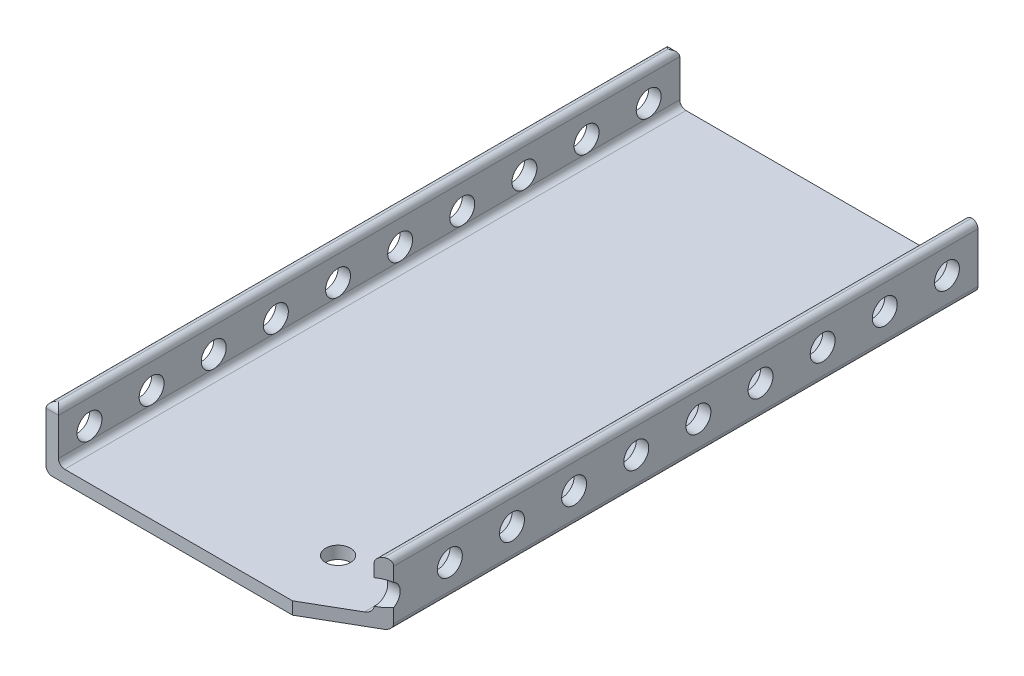
from build123d import *

# Parameters (mm, degrees)
SKETCH1_W           = 50
SKETCH1_H           = 100
BOSS_EXTRUDE1_DEPTH = 2
SKETCH2_W           = 2
SKETCH2_H           = 100
BOSS_EXTRUDE2_DEPTH = 8
FILLET1_R           = 1
SKETCH3_R           = 2.005
CUT_EXTRUDE1_DEPTH  = 72.414284285
SKETCH4_R           = 2.005
CUT_EXTRUDE2_DEPTH  = 10
CUT_EXTRUDE3_DEPTH  = 57.78908359


with BuildPart() as part:
    # Sketch1 → Boss-Extrude1 (new body)
    with BuildSketch(Plane(origin=(0, 0, 0), x_dir=(1, 0, 0), z_dir=(0, 1, 0))):
        Rectangle(SKETCH1_W, SKETCH1_H)
    extrude(amount=BOSS_EXTRUDE1_DEPTH)

    # Sketch2 → Boss-Extrude2 (add)
    with BuildSketch(Plane(origin=(0, 2, 0), x_dir=(1, 0, 0), z_dir=(0, 1, 0))):
        with Locations((-24, 0)):
            Rectangle(SKETCH2_W, SKETCH2_H)
        with Locations((24, 0)):
            Rectangle(SKETCH2_W, SKETCH2_H)
    extrude(amount=BOSS_EXTRUDE2_DEPTH)

    # Fillet1
    fillet1_edges = [part.edges().sort_by_distance(p)[0] for p in [
        (-24, 10, -50),
        (-23, 10, 0),
        (-24, 10, 50),
        (-25, 10, 0),
        (25, 0, 0),
        (-25, 0, 0),
        (25, 10, 0),
        (23, 10, 0),
        (-23, 2, 0),
        (23, 2, 0),
    ]]
    fillet(fillet1_edges, radius=FILLET1_R - 0.0001)  # a hair under: the kernel refuses the full size

    # Sketch3 → Cut-Extrude1 (cut, through all)
    with BuildSketch(Plane.ZY.offset(25)):
        with Locations((-45, 5)):
            Circle(SKETCH3_R)
        with Locations((-35, 5)):
            Circle(SKETCH3_R)
        with Locations((-25, 5)):
            Circle(SKETCH3_R)
        with Locations((-15, 5)):
            Circle(SKETCH3_R)
        with Locations((-5, 5)):
            Circle(SKETCH3_R)
        with Locations((5, 5)):
            Circle(SKETCH3_R)
        with Locations((15, 5)):
            Circle(SKETCH3_R)
        with Locations((25, 5)):
            Circle(SKETCH3_R)
        with Locations((35, 5)):
            Circle(SKETCH3_R)
        with Locations((45, 5)):
            Circle(SKETCH3_R)
    extrude(amount=-CUT_EXTRUDE1_DEPTH, mode=Mode.SUBTRACT)

    # Sketch4 → Cut-Extrude2 (cut)
    with BuildSketch(Plane(origin=(0, 2, 0), x_dir=(1, 0, 0), z_dir=(0, 1, 0))):
        with Locations(Location((12, -40, 0), (0, 0, 270))):
            Circle(SKETCH4_R)
    extrude(amount=-CUT_EXTRUDE2_DEPTH, mode=Mode.SUBTRACT)

    # Sketch5 → Cut-Extrude3 (cut, through all)
    with BuildSketch(Plane.XZ):
        Polygon((25, 50), (14.68, 50), (25, 44.04), align=None)
    extrude(amount=-CUT_EXTRUDE3_DEPTH, mode=Mode.SUBTRACT)


solid = part.part
